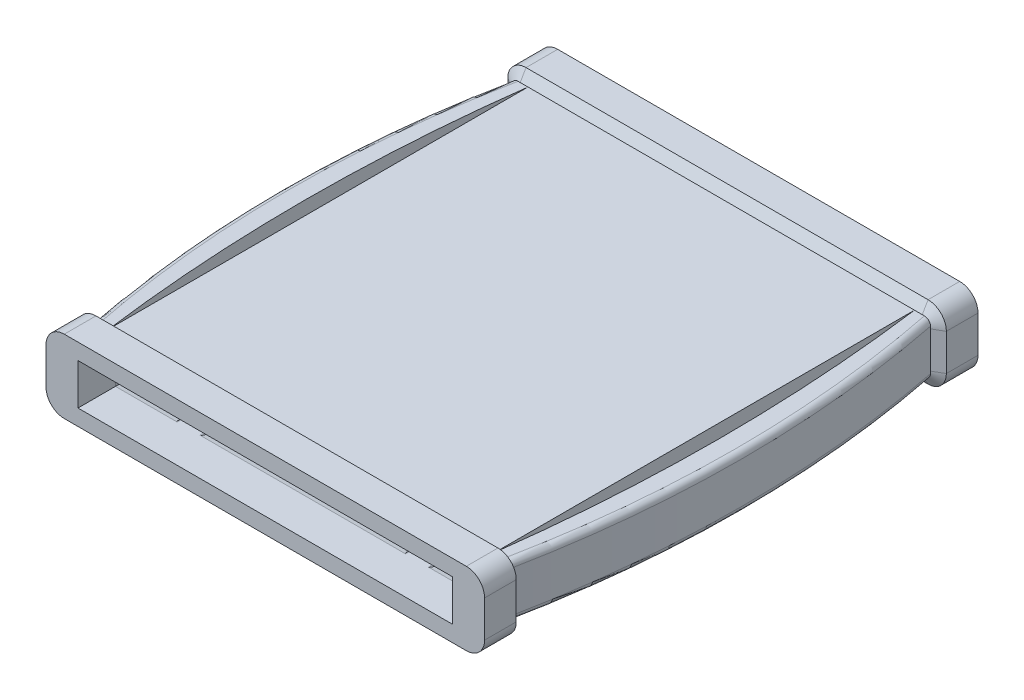
from build123d import *
from OCP.BRepFilletAPI import BRepFilletAPI_MakeChamfer

# Parameters (mm, degrees)
SKETCH1_W                                  = 42.3
SKETCH1_H                                  = 5.8
SKETCH1_W_2                                = 41.5
SKETCH1_H_2                                = 5
CORE_POCKET_DEPTH                          = 27
SKETCH2_W                                  = 41
SKETCH2_H                                  = 4.5
BOSS_EXTRUDE2_DEPTH                        = 4.1
CHAMFER2_SIZE                              = 1.1
CHAMFER2_SIZE_2                            = 0.635085296
CHAMFER3_SIZE                              = 1.417820455
CHAMFER3_SIZE_2                            = 0.25
SIDE_SUPPORT_DEPTH                         = 2.9
SIDE_SUPPORT_FILLET_R                      = 0.65
SIDE_SUPPORT_FILLET_OF_SIDE_SUPPORT_MIRR_R = 0.65
BOSS_EXTRUDE3_START                        = 4.1
SKETCH5_W                                  = 3
SKETCH5_H                                  = 0.25
BOSS_EXTRUDE3_DEPTH                        = 45.8
FILLET1_R                                  = 0.25


# Read off the part's stored shape, not the designer's step: Mirror1
# Some blends are built 0.0001 mm under size
with BuildPart() as part:
    # Sketch1 → Core-Pocket (new, symmetric)
    with BuildSketch(Plane.XY):
        Rectangle(SKETCH1_W, SKETCH1_H)
        Rectangle(SKETCH1_W_2, SKETCH1_H_2, mode=Mode.SUBTRACT)
    extrude(amount=CORE_POCKET_DEPTH, both=True)

    # Sketch2 → Boss-Extrude2 (add)
    with BuildSketch(Plane.XY.offset(27)):
        with BuildLine():
            Line((-22, -4), (22, -4))
            ThreePointArc((22, -4), (23.414213562, -3.414213562), (24, -2))
            Line((24, -2), (24, 2))
            ThreePointArc((24, 2), (23.414213562, 3.414213562), (22, 4))
            Line((22, 4), (-22, 4))
            ThreePointArc((-22, 4), (-23.414213562, 3.414213562), (-24, 2))
            Line((-24, 2), (-24, -2))
            ThreePointArc((-24, -2), (-23.414213562, -3.414213562), (-22, -4))
        make_face()
        Rectangle(SKETCH2_W, SKETCH2_H, mode=Mode.SUBTRACT)
    extrude(amount=-BOSS_EXTRUDE2_DEPTH)

    # Chamfer2
    chamfer2_edges_1 = [part.edges().sort_by_distance(p)[0] for p in [
        (23.414213562, 3.414213562, 22.9),
    ]]
    chamfer2_side_1 = [part.faces().sort_by_distance(p)[0] for p in [
        (23.4052321, 3.4052321, 22.9),
    ]]
    chamfer2_edges_2 = [part.edges().sort_by_distance(p)[0] for p in [
        (24, 0, 22.9),
    ]]
    chamfer2_side_2 = [part.faces().sort_by_distance(p)[0] for p in [
        (23.987298294, 0, 22.9),
    ]]
    chamfer2_edges_3 = [part.edges().sort_by_distance(p)[0] for p in [
        (23.414213562, -3.414213562, 22.9),
    ]]
    chamfer2_side_3 = [part.faces().sort_by_distance(p)[0] for p in [
        (23.4052321, -3.4052321, 22.9),
    ]]
    chamfer2_edges_4 = [part.edges().sort_by_distance(p)[0] for p in [
        (0, -4, 22.9),
    ]]
    chamfer2_side_4 = [part.faces().sort_by_distance(p)[0] for p in [
        (0, -3.987298294, 22.9),
    ]]
    chamfer2_edges_5 = [part.edges().sort_by_distance(p)[0] for p in [
        (-23.414213562, -3.414213562, 22.9),
    ]]
    chamfer2_side_5 = [part.faces().sort_by_distance(p)[0] for p in [
        (-23.4052321, -3.4052321, 22.9),
    ]]
    chamfer2_edges_6 = [part.edges().sort_by_distance(p)[0] for p in [
        (-24, 0, 22.9),
    ]]
    chamfer2_side_6 = [part.faces().sort_by_distance(p)[0] for p in [
        (-23.987298294, 0, 22.9),
    ]]
    chamfer2_edges_7 = [part.edges().sort_by_distance(p)[0] for p in [
        (-23.414213562, 3.414213562, 22.9),
    ]]
    chamfer2_side_7 = [part.faces().sort_by_distance(p)[0] for p in [
        (-23.4052321, 3.4052321, 22.9),
    ]]
    chamfer2_edges_8 = [part.edges().sort_by_distance(p)[0] for p in [
        (0, 4, 22.9),
    ]]
    chamfer2_side_8 = [part.faces().sort_by_distance(p)[0] for p in [
        (0, 3.987298294, 22.9),
    ]]
    chamfer2 = BRepFilletAPI_MakeChamfer(part.part.solid().wrapped)
    for e in chamfer2_edges_1:
        chamfer2.Add(CHAMFER2_SIZE - 0.0001, CHAMFER2_SIZE_2 - 0.0001, e.wrapped, chamfer2_side_1[0].wrapped)
    for e in chamfer2_edges_2:
        chamfer2.Add(CHAMFER2_SIZE - 0.0001, CHAMFER2_SIZE_2 - 0.0001, e.wrapped, chamfer2_side_2[0].wrapped)
    for e in chamfer2_edges_3:
        chamfer2.Add(CHAMFER2_SIZE - 0.0001, CHAMFER2_SIZE_2 - 0.0001, e.wrapped, chamfer2_side_3[0].wrapped)
    for e in chamfer2_edges_4:
        chamfer2.Add(CHAMFER2_SIZE - 0.0001, CHAMFER2_SIZE_2 - 0.0001, e.wrapped, chamfer2_side_4[0].wrapped)
    for e in chamfer2_edges_5:
        chamfer2.Add(CHAMFER2_SIZE - 0.0001, CHAMFER2_SIZE_2 - 0.0001, e.wrapped, chamfer2_side_5[0].wrapped)
    for e in chamfer2_edges_6:
        chamfer2.Add(CHAMFER2_SIZE - 0.0001, CHAMFER2_SIZE_2 - 0.0001, e.wrapped, chamfer2_side_6[0].wrapped)
    for e in chamfer2_edges_7:
        chamfer2.Add(CHAMFER2_SIZE - 0.0001, CHAMFER2_SIZE_2 - 0.0001, e.wrapped, chamfer2_side_7[0].wrapped)
    for e in chamfer2_edges_8:
        chamfer2.Add(CHAMFER2_SIZE - 0.0001, CHAMFER2_SIZE_2 - 0.0001, e.wrapped, chamfer2_side_8[0].wrapped)
    add(Compound.cast(chamfer2.Shape()), mode=Mode.REPLACE)  # a hair under: the kernel refuses the full size

    # Chamfer3
    # the kernel refuses this chamfer: 1.417820455, 0.25 mm, written as the material it adds along each edge
    with BuildSketch(Plane(origin=(-20.75, 2.5, 22.9), x_dir=(0, 0.006682531656101647, -0.9999776716360547), z_dir=(1, 0, 0)), Plane(origin=(20.75, -2.5, 22.9), x_dir=(0, -0.006682531656101647, -0.9999776716360547), z_dir=(-1, 0, 0))) as chamfer3_piece_1:
        Polygon((CHAMFER3_SIZE * 0.999977671569, -CHAMFER3_SIZE * 0.00668253165565), (-CHAMFER3_SIZE_2 * 0.0066825316561, -CHAMFER3_SIZE_2 * 0.999977671636), (0, 0), align=None)
    extrude(amount=41.5)
    with BuildSketch(Plane(origin=(-20.75, -2.5, 22.9), x_dir=(-0.006682531656101949, 0, -0.9999776716360547), z_dir=(0, 1, 0)), Plane(origin=(20.75, 2.5, 22.9), x_dir=(0.006682531656101949, 0, -0.9999776716360547), z_dir=(0, -1, 0))) as chamfer3_piece_2:
        Polygon((CHAMFER3_SIZE * 0.999977671569, -CHAMFER3_SIZE * 0.00668253165565), (-CHAMFER3_SIZE_2 * 0.0066825316561, -CHAMFER3_SIZE_2 * 0.999977671636), (0, 0), align=None)
    extrude(amount=5)

    # Mirror1: part across plane


with BuildPart() as part_1:
    add(part.part)
    add(part.part.mirror(Plane.XY))

    # Sketch4 → Side support (add, symmetric)
    with BuildSketch(Plane(origin=(0, 0, 0), x_dir=(1, 0, 0), z_dir=(0, 1, 0))):
        with BuildLine():
            Line((21.15, -22.9), (22.9, -22.9))
            ThreePointArc((22.9, -22.9), (25.15, 0), (22.9, 22.9))
            Line((22.9, 22.9), (21.15, 22.9))
            ThreePointArc((21.15, 22.9), (22.65, 0), (21.15, -22.9))
        make_face()
    side_support = extrude(amount=SIDE_SUPPORT_DEPTH, both=True)

    # side support fillet
    side_support_fillet_edges = [part_1.edges().sort_by_distance(p)[0] for p in [
        (25.15, 2.9, 0),
        (25.15, -2.9, 0),
    ]]
    fillet(side_support_fillet_edges, radius=SIDE_SUPPORT_FILLET_R)

    # Side support mirror: Side support across plane
    add(side_support.mirror(Plane(origin=(0, 0, 0), x_dir=(0, 0, 1), z_dir=(1, 0, 0))))

    # side support fillet of Side support mirr
    side_support_fillet_of_side_support_mirr_edges = [part_1.edges().sort_by_distance(p)[0] for p in [
        (-25.15, 2.9, 0),
        (-25.15, -2.9, 0),
    ]]
    fillet(side_support_fillet_of_side_support_mirr_edges, radius=SIDE_SUPPORT_FILLET_OF_SIDE_SUPPORT_MIRR_R)

    # Sketch5 → Boss-Extrude3 (add)
    with BuildSketch(Plane.XY.offset(-27).offset(BOSS_EXTRUDE3_START)):
        with Locations((-12.5, -2.375)):
            Rectangle(SKETCH5_W, SKETCH5_H)
        with Locations((12.5, -2.375)):
            Rectangle(SKETCH5_W, SKETCH5_H)
        with Locations((12.5, 2.375)):
            Rectangle(SKETCH5_W, SKETCH5_H)
        with Locations((-12.5, 2.375)):
            Rectangle(SKETCH5_W, SKETCH5_H)
    extrude(amount=BOSS_EXTRUDE3_DEPTH)

    # Fillet1
    fillet1_edges = [part_1.edges().sort_by_distance(p)[0] for p in [
        (14, -2.25, 0),
        (11, -2.25, 0),
        (-14, -2.25, 0),
        (-11, -2.25, 0),
    ]]
    fillet(fillet1_edges, radius=FILLET1_R - 0.0001)  # a hair under: the kernel refuses the full size


solid = part_1.part
